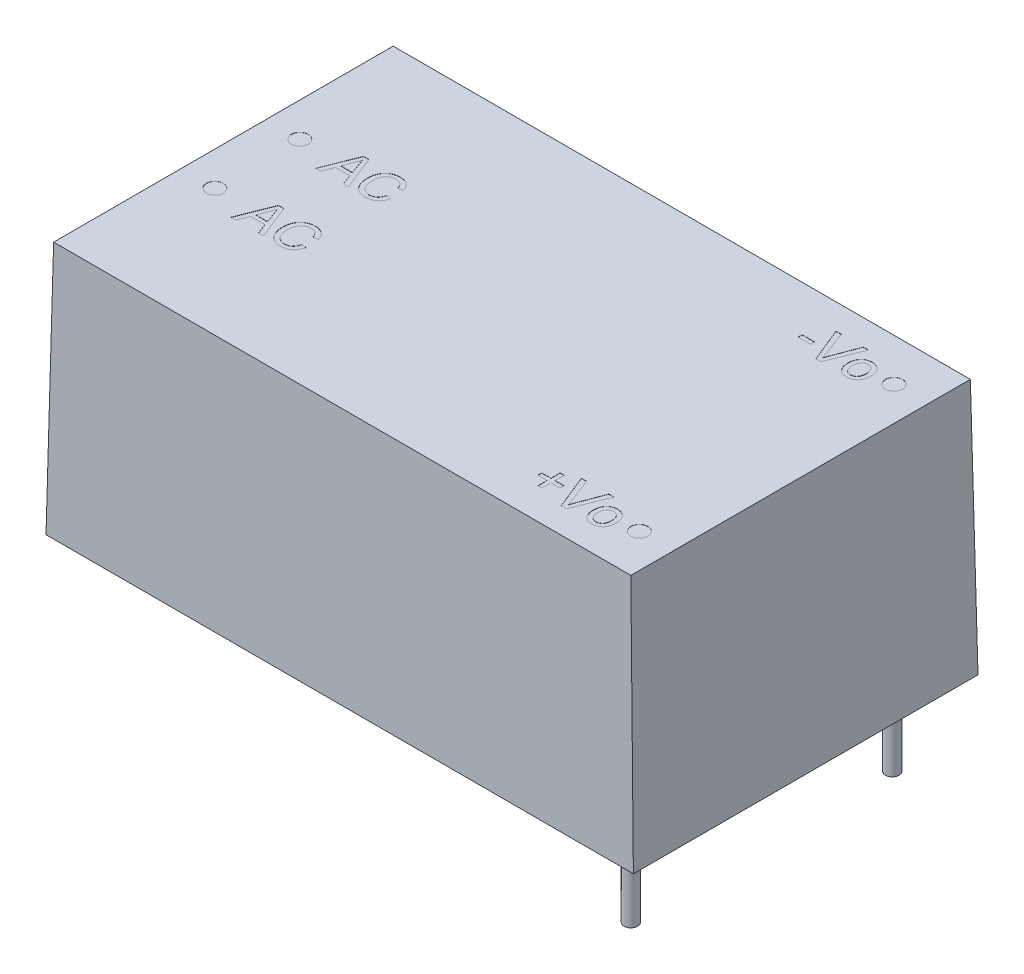
from build123d import *

# Parameters (mm, degrees)
SKETCH_3_R          = 0.4
EXTRUDE_1_DEPTH     = 5
EXTRUDE_1_2_DEPTH   = 5
EXTRUDE_1_3_DEPTH   = 5
EXTRUDE_1_4_DEPTH   = 5
SKETCH_4_R          = 0.5
SKETCH_4_W          = 0.743589744
SKETCH_4_H          = 0.230769231
CUT_EXTRUDE_1_DEPTH = 0.01


with BuildPart() as part:
    # Эскиз1 → По сечениям1 section 0
    with BuildSketch(Plane(origin=(0, 0, 0), x_dir=(1, 0, 0), z_dir=(0, 1, 0))):
        with BuildLine():
            Line((-17.3, 10.15), (17.3, 10.15))
            Line((17.3, 10.15), (17.3, -10.15))
            Line((17.3, -10.15), (-17.3, -10.15))
            Line((-17.3, -10.15), (-17.3, 10.15))
        make_face()
    # Эскиз2 → По сечениям1 section 1
    with BuildSketch(Plane(origin=(0, 15, 0), x_dir=(1, 0, 0), z_dir=(0, 1, 0))):
        with BuildLine():
            Line((-17, 10), (17, 10))
            Line((17, 10), (17, -10))
            Line((17, -10), (-17, -10))
            Line((-17, -10), (-17, 10))
        make_face()
    loft()

    # Эскиз4 → Вырез-Вытянуть1 (cut)
    # profile 1 of 14: a face of its own
    with BuildSketch(Plane(origin=(0, 15, 0), x_dir=(1, 0, 0), z_dir=(0, 1, 0))):
        with Locations((-15, 2.5)):
            Circle(SKETCH_4_R)
    # profile 2 of 14: a face of its own
    with BuildSketch(Plane(origin=(0, 15, 0), x_dir=(1, 0, 0), z_dir=(0, 1, 0))):
        with Locations((-15, -2.5)):
            Circle(SKETCH_4_R)
    # profile 3 of 14: a face of its own
    with BuildSketch(Plane(origin=(0, 15, 0), x_dir=(1, 0, 0), z_dir=(0, 1, 0))):
        with Locations((15, 7.5)):
            Circle(SKETCH_4_R)
    # profile 4 of 14: a face of its own
    with BuildSketch(Plane(origin=(0, 15, 0), x_dir=(1, 0, 0), z_dir=(0, 1, 0))):
        with Locations((15, -7.5)):
            Circle(SKETCH_4_R)
    # profile 5 of 14: a face of its own
    with BuildSketch(Plane(origin=(0, 15, 0), x_dir=(1, 0, 0), z_dir=(0, 1, 0))):
        Polygon((-13.04286859, 1.5), (-12.248798077, 3.5), (-11.930689103, 3.5), (-11.13661859, 1.5), (-11.435897436, 1.5), (-11.663461538, 2.115384615), (-12.516025641, 2.115384615), (-12.743589744, 1.5), align=None)
        with BuildLine():
            Line((-12.431089744, 2.346153846), (-11.748397436, 2.346153846))
            Line((-11.748397436, 2.346153846), (-11.942708333, 2.871794872))
            add(Edge.make_bspline(
                [(-11.942708333, 2.871794872), (-11.950157519, 2.892104925), (-11.964722085, 2.931814913), (-11.986442239, 2.989510174), (-12.006285423, 3.044299961), (-12.025743294, 3.095398669), (-12.043308261, 3.143548556), (-12.059498342, 3.188424393), (-12.075510195, 3.22971427), (-12.085119133, 3.256391785), (-12.08974359, 3.269230769)],
                knots=[0, 0, 0, 0, 1.225184869, 2.395467751, 3.491410812, 4.525364584, 5.492066482, 6.394148129, 7.227157926, 8, 8, 8, 8], degree=3))
            add(Edge.make_bspline(
                [(-12.08974359, 3.269230769), (-12.097393333, 3.237570966), (-12.112724362, 3.174120816), (-12.144823804, 3.081157834), (-12.181544451, 2.98904504), (-12.211365992, 2.929688185), (-12.226362179, 2.899839744)],
                knots=[0, 0, 0, 0, 0.9891762, 1.982431084, 2.985436691, 4, 4, 4, 4], degree=3))
            Line((-12.226362179, 2.899839744), (-12.431089744, 2.346153846))
        make_face(mode=Mode.SUBTRACT)
    # profile 6 of 14: a face of its own
    with BuildSketch(Plane(origin=(0, 15, 0), x_dir=(1, 0, 0), z_dir=(0, 1, 0))):
        with BuildLine():
            Line((-9.564102564, 2.205929487), (-9.282051282, 2.140224359))
            add(Edge.make_bspline(
                [(-9.282051282, 2.140224359), (-9.289117454, 2.113788476), (-9.302939763, 2.062076607), (-9.330268148, 1.988071199), (-9.360940908, 1.918620281), (-9.395702304, 1.853906797), (-9.434932796, 1.794302812), (-9.477592934, 1.739042298), (-9.525372427, 1.68928412), (-9.576518187, 1.643879887), (-9.631428441, 1.603833474), (-9.689441158, 1.569252662), (-9.750275918, 1.539831411), (-9.814178597, 1.51563718), (-9.881190621, 1.497428947), (-9.950966947, 1.48415772), (-10.023711036, 1.475983418), (-10.073295901, 1.474907247), (-10.098557692, 1.474358974)],
                knots=[0, 0, 0, 0, 1.145254194, 2.240259345, 3.299159039, 4.322497661, 5.312016644, 6.284080175, 7.241264552, 8.196044782, 9.144516039, 10.082428046, 11.020306713, 11.970622414, 12.939253955, 13.924100776, 14.94240044, 16, 16, 16, 16], degree=3))
            add(Edge.make_bspline(
                [(-10.098557692, 1.474358974), (-10.124476779, 1.474735532), (-10.175185401, 1.475472237), (-10.249470608, 1.481464402), (-10.320123135, 1.491856879), (-10.387011039, 1.506295738), (-10.450359457, 1.52414849), (-10.509905701, 1.546608834), (-10.565545472, 1.57351471), (-10.617742882, 1.604113645), (-10.666276229, 1.638875413), (-10.712249178, 1.676861888), (-10.75454566, 1.719118797), (-10.794223247, 1.764648414), (-10.830417746, 1.814051337), (-10.86446076, 1.866656409), (-10.89469067, 1.923390528), (-10.922227774, 1.983201841), (-10.946397678, 2.045511268), (-10.967779589, 2.109088026), (-10.98526047, 2.174058798), (-11.00031038, 2.239876867), (-11.011243411, 2.307096046), (-11.019923899, 2.375211985), (-11.024696606, 2.444642295), (-11.025324644, 2.491312842), (-11.025641026, 2.514823718)],
                knots=[0, 0, 0, 0, 1.180702053, 2.309949215, 3.392367133, 4.431746864, 5.425408375, 6.388154007, 7.326956194, 8.237882283, 9.141054626, 10.043899035, 10.951650021, 11.86168169, 12.792564695, 13.739356664, 14.713891418, 15.718426911, 16.737522708, 17.757217648, 18.772674716, 19.801476837, 20.831699174, 21.873853055, 22.928926693, 24, 24, 24, 24], degree=3))
            add(Edge.make_bspline(
                [(-11.025641026, 2.514823718), (-11.025188533, 2.540204657), (-11.024294521, 2.590350981), (-11.01924784, 2.664343339), (-11.009978916, 2.735755016), (-10.997107076, 2.804632985), (-10.980819049, 2.871033028), (-10.960713306, 2.934987495), (-10.937044183, 2.996414555), (-10.909883839, 3.055381946), (-10.879051827, 3.111231435), (-10.845468354, 3.164042418), (-10.808332328, 3.21294776), (-10.768744775, 3.258881813), (-10.72571697, 3.301079722), (-10.679380301, 3.339637077), (-10.63013454, 3.374905568), (-10.577986877, 3.406557777), (-10.523618941, 3.434330935), (-10.467838272, 3.459068728), (-10.410423006, 3.479344713), (-10.351828348, 3.496203379), (-10.291928148, 3.509624443), (-10.230582443, 3.518599151), (-10.167847917, 3.524447765), (-10.125547401, 3.525240393), (-10.104166667, 3.525641026)],
                knots=[0, 0, 0, 0, 1.185634383, 2.342514083, 3.462112933, 4.547331452, 5.613960142, 6.653690668, 7.676612054, 8.686959706, 9.683658101, 10.654407272, 11.607580201, 12.5494388, 13.484601218, 14.419076806, 15.362504069, 16.311442244, 17.265594461, 18.212500624, 19.159571152, 20.107257795, 21.059246075, 22.024387127, 23.001429356, 24, 24, 24, 24], degree=3))
            add(Edge.make_bspline(
                [(-10.104166667, 3.525641026), (-10.080244505, 3.525190105), (-10.033223128, 3.524303775), (-9.964227636, 3.517013539), (-9.898147968, 3.504803191), (-9.83469779, 3.48878437), (-9.774536781, 3.466851269), (-9.717011791, 3.440775332), (-9.662695078, 3.409448254), (-9.611164013, 3.373730957), (-9.563257442, 3.333557572), (-9.518304963, 3.28988783), (-9.478139502, 3.241630304), (-9.441170264, 3.189952915), (-9.408560423, 3.134139071), (-9.379110296, 3.074675411), (-9.353784044, 3.01111989), (-9.340233238, 2.966851712), (-9.333333333, 2.944310897)],
                knots=[0, 0, 0, 0, 1.098391872, 2.158997981, 3.181470371, 4.182549255, 5.160268219, 6.118029851, 7.079534476, 8.035645336, 8.993622929, 9.94770573, 10.909620999, 11.872786677, 12.862530088, 13.874594564, 14.917769567, 16, 16, 16, 16], degree=3))
            Line((-9.333333333, 2.944310897), (-9.615384615, 2.883814103))
            add(Edge.make_bspline(
                [(-9.615384615, 2.883814103), (-9.620923662, 2.90111302), (-9.631765291, 2.934972355), (-9.651015663, 2.983227925), (-9.671805423, 3.028024859), (-9.694629801, 3.069058649), (-9.71953826, 3.106339124), (-9.745957227, 3.140319371), (-9.774519672, 3.170365145), (-9.804644611, 3.197169226), (-9.83710996, 3.220003739), (-9.871154588, 3.240238875), (-9.907496328, 3.256980364), (-9.945612376, 3.271140205), (-9.985858998, 3.28191737), (-10.028072306, 3.289499531), (-10.072289389, 3.293887714), (-10.102420847, 3.294539415), (-10.117788462, 3.294871795)],
                knots=[0, 0, 0, 0, 1.235697765, 2.418642872, 3.532555292, 4.594392283, 5.610119701, 6.580908344, 7.519430642, 8.427315627, 9.319973334, 10.216139639, 11.118687699, 12.038725643, 12.980015607, 13.949697744, 14.954307006, 16, 16, 16, 16], degree=3))
            add(Edge.make_bspline(
                [(-10.117788462, 3.294871795), (-10.135431889, 3.294615806), (-10.170131304, 3.294112352), (-10.221108919, 3.288602104), (-10.27006516, 3.280486045), (-10.316635158, 3.268315317), (-10.361073747, 3.253141585), (-10.403117222, 3.234247603), (-10.443123222, 3.212101641), (-10.48064526, 3.186570708), (-10.515367997, 3.157869025), (-10.548233709, 3.127526856), (-10.577664475, 3.094129112), (-10.60478258, 3.058777046), (-10.628798345, 3.020845965), (-10.650416557, 2.980852533), (-10.669499416, 2.938468975), (-10.690301027, 2.878817326), (-10.711511059, 2.801987383), (-10.729910787, 2.707972434), (-10.74163098, 2.612476286), (-10.742935442, 2.548243836), (-10.743589744, 2.516025641)],
                knots=[0, 0, 0, 0, 0.935256702, 1.839373932, 2.716087708, 3.564631604, 4.388828665, 5.203538865, 6.005592122, 6.810952829, 7.606223804, 8.392839071, 9.180346482, 9.963639178, 10.753404291, 11.558266631, 12.372976832, 13.215232055, 14.905983541, 16.594894834, 18.292041732, 20, 20, 20, 20], degree=3))
            add(Edge.make_bspline(
                [(-10.743589744, 2.516025641), (-10.742851784, 2.475516652), (-10.741420076, 2.396925545), (-10.727292633, 2.28303405), (-10.705753409, 2.17680394), (-10.679758669, 2.093923289), (-10.653683333, 2.03278896), (-10.632594912, 1.989975708), (-10.60852332, 1.950358401), (-10.582067306, 1.913712049), (-10.552886088, 1.880143547), (-10.521386221, 1.849474577), (-10.487560667, 1.821410031), (-10.451008627, 1.797263663), (-10.413137032, 1.775823793), (-10.374423793, 1.756759051), (-10.334844535, 1.740634937), (-10.294239573, 1.728109397), (-10.253179109, 1.717285589), (-10.211210904, 1.71021497), (-10.168346926, 1.706224535), (-10.139564824, 1.705496579), (-10.125, 1.705128205)],
                knots=[0, 0, 0, 0, 2.10686522, 4.087509323, 5.961373225, 7.741398778, 8.594514555, 9.418024779, 10.222433421, 11.003575649, 11.767087398, 12.533660211, 13.289033706, 14.050297079, 14.809623433, 15.552362432, 16.294320901, 17.0305302, 17.761969017, 18.502233515, 19.242073914, 20, 20, 20, 20], degree=3))
            add(Edge.make_bspline(
                [(-10.125, 1.705128205), (-10.107618877, 1.705492724), (-10.073285012, 1.706212777), (-10.022947208, 1.712515445), (-9.974422258, 1.72180325), (-9.928298036, 1.736135271), (-9.883954119, 1.753683151), (-9.841753829, 1.775322757), (-9.801829881, 1.801348886), (-9.763712679, 1.830899112), (-9.72810514, 1.864522219), (-9.695472745, 1.901947323), (-9.666197799, 1.94334504), (-9.639052558, 1.988050997), (-9.616245566, 2.037400726), (-9.595120907, 2.089923329), (-9.577518314, 2.146482061), (-9.568638721, 2.185829022), (-9.564102564, 2.205929487)],
                knots=[0, 0, 0, 0, 1.013374089, 2.001772144, 2.95501459, 3.891367103, 4.814208647, 5.733921849, 6.652182523, 7.590185968, 8.54346024, 9.504121027, 10.481158517, 11.497760682, 12.549996529, 13.647863555, 14.798406869, 16, 16, 16, 16], degree=3))
        make_face()
    # profile 7 of 14: a face of its own
    with BuildSketch(Plane(origin=(0, 15, 0), x_dir=(1, 0, 0), z_dir=(0, 1, 0))):
        Polygon((-13.04286859, -3.5), (-12.248798077, -1.5), (-11.930689103, -1.5), (-11.13661859, -3.5), (-11.435897436, -3.5), (-11.663461538, -2.884615385), (-12.516025641, -2.884615385), (-12.743589744, -3.5), align=None)
        with BuildLine():
            Line((-12.431089744, -2.653846154), (-11.748397436, -2.653846154))
            Line((-11.748397436, -2.653846154), (-11.942708333, -2.128205128))
            add(Edge.make_bspline(
                [(-11.942708333, -2.128205128), (-11.950157519, -2.107895075), (-11.964722085, -2.068185087), (-11.986442239, -2.010489826), (-12.006285423, -1.955700039), (-12.025743294, -1.904601331), (-12.043308261, -1.856451444), (-12.059498342, -1.811575607), (-12.075510195, -1.77028573), (-12.085119133, -1.743608215), (-12.08974359, -1.730769231)],
                knots=[0, 0, 0, 0, 1.225184869, 2.395467751, 3.491410812, 4.525364584, 5.492066482, 6.394148129, 7.227157926, 8, 8, 8, 8], degree=3))
            add(Edge.make_bspline(
                [(-12.08974359, -1.730769231), (-12.097393333, -1.762429034), (-12.112724362, -1.825879184), (-12.144823804, -1.918842166), (-12.181544451, -2.01095496), (-12.211365992, -2.070311815), (-12.226362179, -2.100160256)],
                knots=[0, 0, 0, 0, 0.9891762, 1.982431084, 2.985436691, 4, 4, 4, 4], degree=3))
            Line((-12.226362179, -2.100160256), (-12.431089744, -2.653846154))
        make_face(mode=Mode.SUBTRACT)
    # profile 8 of 14: a face of its own
    with BuildSketch(Plane(origin=(0, 15, 0), x_dir=(1, 0, 0), z_dir=(0, 1, 0))):
        with BuildLine():
            Line((-9.564102564, -2.794070513), (-9.282051282, -2.859775641))
            add(Edge.make_bspline(
                [(-9.282051282, -2.859775641), (-9.289117454, -2.886211524), (-9.302939763, -2.937923393), (-9.330268148, -3.011928801), (-9.360940908, -3.081379719), (-9.395702304, -3.146093203), (-9.434932796, -3.205697188), (-9.477592934, -3.260957702), (-9.525372427, -3.31071588), (-9.576518187, -3.356120113), (-9.631428441, -3.396166526), (-9.689441158, -3.430747338), (-9.750275918, -3.460168589), (-9.814178597, -3.48436282), (-9.881190621, -3.502571053), (-9.950966947, -3.51584228), (-10.023711036, -3.524016582), (-10.073295901, -3.525092753), (-10.098557692, -3.525641026)],
                knots=[0, 0, 0, 0, 1.145254194, 2.240259345, 3.299159039, 4.322497661, 5.312016644, 6.284080175, 7.241264552, 8.196044782, 9.144516039, 10.082428046, 11.020306713, 11.970622414, 12.939253955, 13.924100776, 14.94240044, 16, 16, 16, 16], degree=3))
            add(Edge.make_bspline(
                [(-10.098557692, -3.525641026), (-10.124476779, -3.525264468), (-10.175185401, -3.524527763), (-10.249470608, -3.518535598), (-10.320123135, -3.508143121), (-10.387011039, -3.493704262), (-10.450359457, -3.47585151), (-10.509905701, -3.453391166), (-10.565545472, -3.42648529), (-10.617742882, -3.395886355), (-10.666276229, -3.361124587), (-10.712249178, -3.323138112), (-10.75454566, -3.280881203), (-10.794223247, -3.235351586), (-10.830417746, -3.185948663), (-10.86446076, -3.133343591), (-10.89469067, -3.076609472), (-10.922227774, -3.016798159), (-10.946397678, -2.954488732), (-10.967779589, -2.890911974), (-10.98526047, -2.825941202), (-11.00031038, -2.760123133), (-11.011243411, -2.692903954), (-11.019923899, -2.624788015), (-11.024696606, -2.555357705), (-11.025324644, -2.508687158), (-11.025641026, -2.485176282)],
                knots=[0, 0, 0, 0, 1.180702053, 2.309949215, 3.392367133, 4.431746864, 5.425408375, 6.388154007, 7.326956194, 8.237882283, 9.141054626, 10.043899035, 10.951650021, 11.86168169, 12.792564695, 13.739356664, 14.713891418, 15.718426911, 16.737522708, 17.757217648, 18.772674716, 19.801476837, 20.831699174, 21.873853055, 22.928926693, 24, 24, 24, 24], degree=3))
            add(Edge.make_bspline(
                [(-11.025641026, -2.485176282), (-11.025188533, -2.459795343), (-11.024294521, -2.409649019), (-11.01924784, -2.335656661), (-11.009978916, -2.264244984), (-10.997107076, -2.195367015), (-10.980819049, -2.128966972), (-10.960713306, -2.065012505), (-10.937044183, -2.003585445), (-10.909883839, -1.944618054), (-10.879051827, -1.888768565), (-10.845468354, -1.835957582), (-10.808332328, -1.78705224), (-10.768744775, -1.741118187), (-10.72571697, -1.698920278), (-10.679380301, -1.660362923), (-10.63013454, -1.625094432), (-10.577986877, -1.593442223), (-10.523618941, -1.565669065), (-10.467838272, -1.540931272), (-10.410423006, -1.520655287), (-10.351828348, -1.503796621), (-10.291928148, -1.490375557), (-10.230582443, -1.481400849), (-10.167847917, -1.475552235), (-10.125547401, -1.474759607), (-10.104166667, -1.474358974)],
                knots=[0, 0, 0, 0, 1.185634383, 2.342514083, 3.462112933, 4.547331452, 5.613960142, 6.653690668, 7.676612054, 8.686959706, 9.683658101, 10.654407272, 11.607580201, 12.5494388, 13.484601218, 14.419076806, 15.362504069, 16.311442244, 17.265594461, 18.212500624, 19.159571152, 20.107257795, 21.059246075, 22.024387127, 23.001429356, 24, 24, 24, 24], degree=3))
            add(Edge.make_bspline(
                [(-10.104166667, -1.474358974), (-10.080244505, -1.474809895), (-10.033223128, -1.475696225), (-9.964227636, -1.482986461), (-9.898147968, -1.495196809), (-9.83469779, -1.51121563), (-9.774536781, -1.533148731), (-9.717011791, -1.559224668), (-9.662695078, -1.590551746), (-9.611164013, -1.626269043), (-9.563257442, -1.666442428), (-9.518304963, -1.71011217), (-9.478139502, -1.758369696), (-9.441170264, -1.810047085), (-9.408560423, -1.865860929), (-9.379110296, -1.925324589), (-9.353784044, -1.98888011), (-9.340233238, -2.033148288), (-9.333333333, -2.055689103)],
                knots=[0, 0, 0, 0, 1.098391872, 2.158997981, 3.181470371, 4.182549255, 5.160268219, 6.118029851, 7.079534476, 8.035645336, 8.993622929, 9.94770573, 10.909620999, 11.872786677, 12.862530088, 13.874594564, 14.917769567, 16, 16, 16, 16], degree=3))
            Line((-9.333333333, -2.055689103), (-9.615384615, -2.116185897))
            add(Edge.make_bspline(
                [(-9.615384615, -2.116185897), (-9.620923662, -2.09888698), (-9.631765291, -2.065027645), (-9.651015663, -2.016772075), (-9.671805423, -1.971975141), (-9.694629801, -1.930941351), (-9.71953826, -1.893660876), (-9.745957227, -1.859680629), (-9.774519672, -1.829634855), (-9.804644611, -1.802830774), (-9.83710996, -1.779996261), (-9.871154588, -1.759761125), (-9.907496328, -1.743019636), (-9.945612376, -1.728859795), (-9.985858998, -1.71808263), (-10.028072306, -1.710500469), (-10.072289389, -1.706112286), (-10.102420847, -1.705460585), (-10.117788462, -1.705128205)],
                knots=[0, 0, 0, 0, 1.235697765, 2.418642872, 3.532555292, 4.594392283, 5.610119701, 6.580908344, 7.519430642, 8.427315627, 9.319973334, 10.216139639, 11.118687699, 12.038725643, 12.980015607, 13.949697744, 14.954307006, 16, 16, 16, 16], degree=3))
            add(Edge.make_bspline(
                [(-10.117788462, -1.705128205), (-10.135431889, -1.705384194), (-10.170131304, -1.705887648), (-10.221108919, -1.711397896), (-10.27006516, -1.719513955), (-10.316635158, -1.731684683), (-10.361073747, -1.746858415), (-10.403117222, -1.765752397), (-10.443123222, -1.787898359), (-10.48064526, -1.813429292), (-10.515367997, -1.842130975), (-10.548233709, -1.872473144), (-10.577664475, -1.905870888), (-10.60478258, -1.941222954), (-10.628798345, -1.979154035), (-10.650416557, -2.019147467), (-10.669499416, -2.061531025), (-10.690301027, -2.121182674), (-10.711511059, -2.198012617), (-10.729910787, -2.292027566), (-10.74163098, -2.387523714), (-10.742935442, -2.451756164), (-10.743589744, -2.483974359)],
                knots=[0, 0, 0, 0, 0.935256702, 1.839373932, 2.716087708, 3.564631604, 4.388828665, 5.203538865, 6.005592122, 6.810952829, 7.606223804, 8.392839071, 9.180346482, 9.963639178, 10.753404291, 11.558266631, 12.372976832, 13.215232055, 14.905983541, 16.594894834, 18.292041732, 20, 20, 20, 20], degree=3))
            add(Edge.make_bspline(
                [(-10.743589744, -2.483974359), (-10.742851784, -2.524483348), (-10.741420076, -2.603074455), (-10.727292633, -2.71696595), (-10.705753409, -2.82319606), (-10.679758669, -2.906076711), (-10.653683333, -2.96721104), (-10.632594912, -3.010024292), (-10.60852332, -3.049641599), (-10.582067306, -3.086287951), (-10.552886088, -3.119856453), (-10.521386221, -3.150525423), (-10.487560667, -3.178589969), (-10.451008627, -3.202736337), (-10.413137032, -3.224176207), (-10.374423793, -3.243240949), (-10.334844535, -3.259365063), (-10.294239573, -3.271890603), (-10.253179109, -3.282714411), (-10.211210904, -3.28978503), (-10.168346926, -3.293775465), (-10.139564824, -3.294503421), (-10.125, -3.294871795)],
                knots=[0, 0, 0, 0, 2.10686522, 4.087509323, 5.961373225, 7.741398778, 8.594514555, 9.418024779, 10.222433421, 11.003575649, 11.767087398, 12.533660211, 13.289033706, 14.050297079, 14.809623433, 15.552362432, 16.294320901, 17.0305302, 17.761969017, 18.502233515, 19.242073914, 20, 20, 20, 20], degree=3))
            add(Edge.make_bspline(
                [(-10.125, -3.294871795), (-10.107618877, -3.294507276), (-10.073285012, -3.293787223), (-10.022947208, -3.287484555), (-9.974422258, -3.27819675), (-9.928298036, -3.263864729), (-9.883954119, -3.246316849), (-9.841753829, -3.224677243), (-9.801829881, -3.198651114), (-9.763712679, -3.169100888), (-9.72810514, -3.135477781), (-9.695472745, -3.098052677), (-9.666197799, -3.05665496), (-9.639052558, -3.011949003), (-9.616245566, -2.962599274), (-9.595120907, -2.910076671), (-9.577518314, -2.853517939), (-9.568638721, -2.814170978), (-9.564102564, -2.794070513)],
                knots=[0, 0, 0, 0, 1.013374089, 2.001772144, 2.95501459, 3.891367103, 4.814208647, 5.733921849, 6.652182523, 7.590185968, 8.54346024, 9.504121027, 10.481158517, 11.497760682, 12.549996529, 13.647863555, 14.798406869, 16, 16, 16, 16], degree=3))
        make_face()
    # profile 9 of 14: a face of its own
    with BuildSketch(Plane(origin=(0, 15, 0), x_dir=(1, 0, 0), z_dir=(0, 1, 0))):
        with BuildLine():
            add(Edge.make_bspline(
                [(12.564102564, 7.230769231), (12.564820561, 7.263246316), (12.566209938, 7.326091847), (12.576159113, 7.417285552), (12.593216248, 7.501949247), (12.617153598, 7.580162449), (12.648109335, 7.651949802), (12.686351236, 7.716908533), (12.730824596, 7.776232049), (12.766316872, 7.809764342), (12.784054487, 7.826522436)],
                knots=[0, 0, 0, 0, 1.189940866, 2.302622481, 3.356378305, 4.350088409, 5.294652018, 6.213657312, 7.107257627, 8, 8, 8, 8], degree=3))
            add(Edge.make_bspline(
                [(12.784054487, 7.826522436), (12.799568371, 7.839401185), (12.830313066, 7.864923692), (12.88049412, 7.897290212), (12.932738182, 7.925098606), (12.987506899, 7.948156012), (13.044973362, 7.965772703), (13.104958626, 7.977999474), (13.16738602, 7.985987507), (13.209910646, 7.986777238), (13.231570513, 7.987179487)],
                knots=[0, 0, 0, 0, 0.994414631, 1.970684744, 2.940793954, 3.912782355, 4.898970837, 5.902128985, 6.931451948, 8, 8, 8, 8], degree=3))
            add(Edge.make_bspline(
                [(13.231570513, 7.987179487), (13.255497047, 7.986504438), (13.302313746, 7.985183578), (13.371014735, 7.976570133), (13.436069858, 7.960563294), (13.498316779, 7.939584699), (13.55681293, 7.911627196), (13.612482237, 7.878296121), (13.66396157, 7.837901542), (13.712237566, 7.79224312), (13.755788118, 7.741181968), (13.793731138, 7.684968973), (13.825863451, 7.62408973), (13.85240651, 7.558486521), (13.872762277, 7.488113486), (13.886950766, 7.413121015), (13.896040015, 7.333690754), (13.896963144, 7.279139008), (13.897435897, 7.251201923)],
                knots=[0, 0, 0, 0, 1.026363227, 2.008269884, 2.962742747, 3.895658536, 4.820662428, 5.738204837, 6.673158329, 7.621267452, 8.584296177, 9.545483285, 10.524327568, 11.531652541, 12.575780624, 13.660990097, 14.802144351, 16, 16, 16, 16], degree=3))
            add(Edge.make_bspline(
                [(13.897435897, 7.251201923), (13.897257772, 7.228492047), (13.896911699, 7.184369798), (13.892728466, 7.120079871), (13.886406966, 7.059519055), (13.877803259, 7.002618427), (13.866213652, 6.949469219), (13.851761254, 6.900114107), (13.835000782, 6.854286537), (13.81573766, 6.811937596), (13.793757644, 6.772725185), (13.769812072, 6.735804145), (13.743299003, 6.701230487), (13.714252422, 6.669061511), (13.683064293, 6.639063914), (13.649521819, 6.611123975), (13.613563084, 6.585643937), (13.562796519, 6.554707768), (13.495790971, 6.522290017), (13.410925089, 6.494508688), (13.322387453, 6.477576138), (13.262093345, 6.475440237), (13.231570513, 6.474358974)],
                knots=[0, 0, 0, 0, 1.174068422, 2.28105775, 3.329581501, 4.321819531, 5.255045276, 6.14001734, 6.978936381, 7.776151739, 8.542754425, 9.301196708, 10.049767304, 10.792968067, 11.540167917, 12.285482871, 13.048063169, 13.816653646, 15.357768987, 16.884132754, 18.422646949, 20, 20, 20, 20], degree=3))
            add(Edge.make_bspline(
                [(13.231570513, 6.474358974), (13.207239283, 6.475018871), (13.159616248, 6.476310472), (13.089943599, 6.485122895), (13.023820003, 6.50022305), (12.961444921, 6.522228156), (12.902262428, 6.549240467), (12.846831788, 6.582961152), (12.795045895, 6.622655465), (12.747362094, 6.668579488), (12.70376315, 6.719709951), (12.666545918, 6.777144714), (12.634692517, 6.839699155), (12.608668346, 6.907643055), (12.588789509, 6.980978458), (12.574514058, 7.059512303), (12.56549059, 7.143352557), (12.564573693, 7.201097964), (12.564102564, 7.230769231)],
                knots=[0, 0, 0, 0, 1.022681766, 2.001674804, 2.94671416, 3.868132449, 4.777362857, 5.676573364, 6.589418535, 7.514523194, 8.454681358, 9.407574523, 10.384198733, 11.400667853, 12.460217505, 13.573389442, 14.753137007, 16, 16, 16, 16], degree=3))
        make_face()
        with BuildLine():
            add(Edge.make_bspline(
                [(12.820512821, 7.231570513), (12.820947967, 7.210194023), (12.821789684, 7.168844802), (12.826813104, 7.108827905), (12.835989969, 7.053109461), (12.848757097, 7.001487044), (12.865132445, 6.953953332), (12.885202264, 6.910427849), (12.908747594, 6.870873697), (12.936279349, 6.8359357), (12.966243282, 6.805054389), (12.998561876, 6.778416811), (13.03278568, 6.755798188), (13.068972856, 6.737355617), (13.106959533, 6.722784329), (13.146828359, 6.712292736), (13.188650036, 6.706268437), (13.217128347, 6.705511878), (13.231570513, 6.705128205)],
                knots=[0, 0, 0, 0, 1.36128903, 2.633184439, 3.831299874, 4.953299848, 6.015607462, 7.027679361, 8.000438392, 8.93945591, 9.853536715, 10.73548639, 11.60109037, 12.460616037, 13.316600729, 14.187036799, 15.080594522, 16, 16, 16, 16], degree=3))
            add(Edge.make_bspline(
                [(13.231570513, 6.705128205), (13.245888573, 6.705455405), (13.274139538, 6.706101004), (13.315416789, 6.712936002), (13.355142544, 6.722741493), (13.392988584, 6.737210065), (13.42864002, 6.756295425), (13.46278771, 6.778870873), (13.494739493, 6.805898178), (13.525046233, 6.836720319), (13.552184595, 6.872173835), (13.576526956, 6.911571337), (13.596527119, 6.955803741), (13.612695907, 7.004193711), (13.625604426, 7.056844271), (13.634738555, 7.113775527), (13.639732641, 7.175124231), (13.640586083, 7.217405874), (13.641025641, 7.239182692)],
                knots=[0, 0, 0, 0, 0.904535546, 1.784739026, 2.638791991, 3.488785886, 4.338695884, 5.191202824, 6.07237792, 6.980061329, 7.919174549, 8.889507933, 9.902165842, 10.981000531, 12.111539881, 13.326270405, 14.622917219, 16, 16, 16, 16], degree=3))
            add(Edge.make_bspline(
                [(13.641025641, 7.239182692), (13.640582378, 7.25975723), (13.639720303, 7.299771356), (13.634753111, 7.357934654), (13.625458296, 7.412153), (13.612939473, 7.462579214), (13.595779269, 7.508798065), (13.576061594, 7.55168577), (13.551719185, 7.590391718), (13.524103002, 7.62513423), (13.493961098, 7.656052806), (13.46192877, 7.683187029), (13.427672341, 7.705470565), (13.392017092, 7.724415278), (13.354385562, 7.738570536), (13.315133376, 7.749278043), (13.273958103, 7.755282359), (13.245878688, 7.756029528), (13.231570513, 7.756410256)],
                knots=[0, 0, 0, 0, 1.329905342, 2.586449315, 3.768451236, 4.882143757, 5.938857988, 6.950440627, 7.927559667, 8.885972819, 9.813736587, 10.714405609, 11.592966897, 12.450023853, 13.318821862, 14.185602452, 15.075453733, 16, 16, 16, 16], degree=3))
            add(Edge.make_bspline(
                [(13.231570513, 7.756410256), (13.217129574, 7.756023398), (13.188653682, 7.755260557), (13.146814403, 7.749281962), (13.107055695, 7.73863519), (13.068875449, 7.724699189), (13.032821885, 7.706079347), (12.99839988, 7.683584901), (12.966525658, 7.656442681), (12.936108445, 7.626038947), (12.908892552, 7.591097002), (12.885186967, 7.55194036), (12.865052606, 7.508686874), (12.848768813, 7.461249129), (12.835986576, 7.409632161), (12.826813877, 7.353912121), (12.821801515, 7.294028815), (12.820951122, 7.252813373), (12.820512821, 7.231570513)],
                knots=[0, 0, 0, 0, 0.920966903, 1.816042154, 2.687956485, 3.542385364, 4.403370762, 5.270444796, 6.159337503, 7.068888003, 8.009500254, 8.976623456, 9.982690403, 11.046802133, 12.170707598, 13.370857791, 14.644913259, 16, 16, 16, 16], degree=3))
        make_face(mode=Mode.SUBTRACT)
    # profile 10 of 14: a face of its own
    with BuildSketch(Plane(origin=(0, 15, 0), x_dir=(1, 0, 0), z_dir=(0, 1, 0))):
        with BuildLine():
            Line((11.398237179, 6.5), (10.591746795, 8.5))
            Line((10.591746795, 8.5), (10.897435897, 8.5))
            Line((10.897435897, 8.5), (11.44150641, 7.06650641))
            add(Edge.make_bspline(
                [(11.44150641, 7.06650641), (11.452153331, 7.038230134), (11.472980903, 6.982915906), (11.50202497, 6.900833384), (11.527988617, 6.821455402), (11.543641771, 6.769129793), (11.551282051, 6.743589744)],
                knots=[0, 0, 0, 0, 1.062747156, 2.078952616, 3.062339733, 4, 4, 4, 4], degree=3))
            add(Edge.make_bspline(
                [(11.551282051, 6.743589744), (11.567547082, 6.797598018), (11.600310346, 6.906388914), (11.639913333, 7.012881249), (11.659855769, 7.06650641)],
                knots=[0, 0, 0, 0, 0.992882236, 2, 2, 2, 2], degree=3))
            Line((11.659855769, 7.06650641), (12.205128205, 8.5))
            Line((12.205128205, 8.5), (12.510817308, 8.5))
            Line((12.510817308, 8.5), (11.703926282, 6.5))
            Line((11.703926282, 6.5), (11.398237179, 6.5))
        make_face()
    # profile 11 of 14: a face of its own
    with BuildSketch(Plane(origin=(0, 15, 0), x_dir=(1, 0, 0), z_dir=(0, 1, 0))):
        with Locations((10.141025641, 7.205128206)):
            Rectangle(SKETCH_4_W, SKETCH_4_H)
    # profile 12 of 14: a face of its own
    with BuildSketch(Plane(origin=(0, 15, 0), x_dir=(1, 0, 0), z_dir=(0, 1, 0))):
        with BuildLine():
            add(Edge.make_bspline(
                [(12.564102564, -7.769230769), (12.564820561, -7.736753684), (12.566209938, -7.673908153), (12.576159113, -7.582714448), (12.593216248, -7.498050753), (12.617153598, -7.419837551), (12.648109335, -7.348050198), (12.686351236, -7.283091467), (12.730824596, -7.223767951), (12.766316872, -7.190235658), (12.784054487, -7.173477564)],
                knots=[0, 0, 0, 0, 1.189940866, 2.302622481, 3.356378305, 4.350088409, 5.294652018, 6.213657312, 7.107257627, 8, 8, 8, 8], degree=3))
            add(Edge.make_bspline(
                [(12.784054487, -7.173477564), (12.799568371, -7.160598815), (12.830313066, -7.135076308), (12.88049412, -7.102709788), (12.932738182, -7.074901394), (12.987506899, -7.051843988), (13.044973362, -7.034227297), (13.104958626, -7.022000526), (13.16738602, -7.014012493), (13.209910646, -7.013222762), (13.231570513, -7.012820513)],
                knots=[0, 0, 0, 0, 0.994414631, 1.970684744, 2.940793954, 3.912782355, 4.898970837, 5.902128985, 6.931451948, 8, 8, 8, 8], degree=3))
            add(Edge.make_bspline(
                [(13.231570513, -7.012820513), (13.255497047, -7.013495562), (13.302313746, -7.014816422), (13.371014735, -7.023429867), (13.436069858, -7.039436706), (13.498316779, -7.060415301), (13.55681293, -7.088372804), (13.612482237, -7.121703879), (13.66396157, -7.162098458), (13.712237566, -7.20775688), (13.755788118, -7.258818032), (13.793731138, -7.315031027), (13.825863451, -7.37591027), (13.85240651, -7.441513479), (13.872762277, -7.511886514), (13.886950766, -7.586878985), (13.896040015, -7.666309246), (13.896963144, -7.720860992), (13.897435897, -7.748798077)],
                knots=[0, 0, 0, 0, 1.026363227, 2.008269884, 2.962742747, 3.895658536, 4.820662428, 5.738204837, 6.673158329, 7.621267452, 8.584296177, 9.545483285, 10.524327568, 11.531652541, 12.575780624, 13.660990097, 14.802144351, 16, 16, 16, 16], degree=3))
            add(Edge.make_bspline(
                [(13.897435897, -7.748798077), (13.897257772, -7.771507953), (13.896911699, -7.815630202), (13.892728466, -7.879920129), (13.886406966, -7.940480945), (13.877803259, -7.997381573), (13.866213652, -8.050530781), (13.851761254, -8.099885893), (13.835000782, -8.145713463), (13.81573766, -8.188062404), (13.793757644, -8.227274815), (13.769812072, -8.264195855), (13.743299003, -8.298769513), (13.714252422, -8.330938489), (13.683064293, -8.360936086), (13.649521819, -8.388876025), (13.613563084, -8.414356063), (13.562796519, -8.445292232), (13.495790971, -8.477709983), (13.410925089, -8.505491312), (13.322387453, -8.522423862), (13.262093345, -8.524559763), (13.231570513, -8.525641026)],
                knots=[0, 0, 0, 0, 1.174068422, 2.28105775, 3.329581501, 4.321819531, 5.255045276, 6.14001734, 6.978936381, 7.776151739, 8.542754425, 9.301196708, 10.049767304, 10.792968067, 11.540167917, 12.285482871, 13.048063169, 13.816653646, 15.357768987, 16.884132754, 18.422646949, 20, 20, 20, 20], degree=3))
            add(Edge.make_bspline(
                [(13.231570513, -8.525641026), (13.207239283, -8.524981129), (13.159616248, -8.523689528), (13.089943599, -8.514877105), (13.023820003, -8.49977695), (12.961444921, -8.477771844), (12.902262428, -8.450759533), (12.846831788, -8.417038848), (12.795045895, -8.377344535), (12.747362094, -8.331420512), (12.70376315, -8.280290049), (12.666545918, -8.222855286), (12.634692517, -8.160300845), (12.608668346, -8.092356945), (12.588789509, -8.019021542), (12.574514058, -7.940487697), (12.56549059, -7.856647443), (12.564573693, -7.798902036), (12.564102564, -7.769230769)],
                knots=[0, 0, 0, 0, 1.022681766, 2.001674804, 2.94671416, 3.868132449, 4.777362857, 5.676573364, 6.589418535, 7.514523194, 8.454681358, 9.407574523, 10.384198733, 11.400667853, 12.460217505, 13.573389442, 14.753137007, 16, 16, 16, 16], degree=3))
        make_face()
        with BuildLine():
            add(Edge.make_bspline(
                [(12.820512821, -7.768429487), (12.820947967, -7.789805977), (12.821789684, -7.831155198), (12.826813104, -7.891172095), (12.835989969, -7.946890539), (12.848757097, -7.998512956), (12.865132445, -8.046046668), (12.885202264, -8.089572151), (12.908747594, -8.129126303), (12.936279349, -8.1640643), (12.966243282, -8.194945611), (12.998561876, -8.221583189), (13.03278568, -8.244201812), (13.068972856, -8.262644383), (13.106959533, -8.277215671), (13.146828359, -8.287707264), (13.188650036, -8.293731563), (13.217128347, -8.294488122), (13.231570513, -8.294871795)],
                knots=[0, 0, 0, 0, 1.36128903, 2.633184439, 3.831299874, 4.953299848, 6.015607462, 7.027679361, 8.000438392, 8.93945591, 9.853536715, 10.73548639, 11.60109037, 12.460616037, 13.316600729, 14.187036799, 15.080594522, 16, 16, 16, 16], degree=3))
            add(Edge.make_bspline(
                [(13.231570513, -8.294871795), (13.245888573, -8.294544595), (13.274139538, -8.293898996), (13.315416789, -8.287063998), (13.355142544, -8.277258507), (13.392988584, -8.262789935), (13.42864002, -8.243704575), (13.46278771, -8.221129127), (13.494739493, -8.194101822), (13.525046233, -8.163279681), (13.552184595, -8.127826165), (13.576526956, -8.088428663), (13.596527119, -8.044196259), (13.612695907, -7.995806289), (13.625604426, -7.943155729), (13.634738555, -7.886224473), (13.639732641, -7.824875769), (13.640586083, -7.782594126), (13.641025641, -7.760817308)],
                knots=[0, 0, 0, 0, 0.904535546, 1.784739026, 2.638791991, 3.488785886, 4.338695884, 5.191202824, 6.07237792, 6.980061329, 7.919174549, 8.889507933, 9.902165842, 10.981000531, 12.111539881, 13.326270405, 14.622917219, 16, 16, 16, 16], degree=3))
            add(Edge.make_bspline(
                [(13.641025641, -7.760817308), (13.640582378, -7.74024277), (13.639720303, -7.700228644), (13.634753111, -7.642065346), (13.625458296, -7.587847), (13.612939473, -7.537420786), (13.595779269, -7.491201935), (13.576061594, -7.44831423), (13.551719185, -7.409608282), (13.524103002, -7.37486577), (13.493961098, -7.343947194), (13.46192877, -7.316812971), (13.427672341, -7.294529435), (13.392017092, -7.275584722), (13.354385562, -7.261429464), (13.315133376, -7.250721957), (13.273958103, -7.244717641), (13.245878688, -7.243970472), (13.231570513, -7.243589744)],
                knots=[0, 0, 0, 0, 1.329905342, 2.586449315, 3.768451236, 4.882143757, 5.938857988, 6.950440627, 7.927559667, 8.885972819, 9.813736587, 10.714405609, 11.592966897, 12.450023853, 13.318821862, 14.185602452, 15.075453733, 16, 16, 16, 16], degree=3))
            add(Edge.make_bspline(
                [(13.231570513, -7.243589744), (13.217129574, -7.243976602), (13.188653682, -7.244739443), (13.146814403, -7.250718038), (13.107055695, -7.26136481), (13.068875449, -7.275300811), (13.032821885, -7.293920653), (12.99839988, -7.316415099), (12.966525658, -7.343557319), (12.936108445, -7.373961053), (12.908892552, -7.408902998), (12.885186967, -7.44805964), (12.865052606, -7.491313126), (12.848768813, -7.538750871), (12.835986576, -7.590367839), (12.826813877, -7.646087879), (12.821801515, -7.705971185), (12.820951122, -7.747186627), (12.820512821, -7.768429487)],
                knots=[0, 0, 0, 0, 0.920966903, 1.816042154, 2.687956485, 3.542385364, 4.403370762, 5.270444796, 6.159337503, 7.068888003, 8.009500254, 8.976623456, 9.982690403, 11.046802133, 12.170707598, 13.370857791, 14.644913259, 16, 16, 16, 16], degree=3))
        make_face(mode=Mode.SUBTRACT)
    # profile 13 of 14: a face of its own
    with BuildSketch(Plane(origin=(0, 15, 0), x_dir=(1, 0, 0), z_dir=(0, 1, 0))):
        with BuildLine():
            Line((11.398237179, -8.5), (10.591746795, -6.5))
            Line((10.591746795, -6.5), (10.897435897, -6.5))
            Line((10.897435897, -6.5), (11.44150641, -7.93349359))
            add(Edge.make_bspline(
                [(11.44150641, -7.93349359), (11.452153331, -7.961769866), (11.472980903, -8.017084094), (11.50202497, -8.099166616), (11.527988617, -8.178544598), (11.543641771, -8.230870207), (11.551282051, -8.256410256)],
                knots=[0, 0, 0, 0, 1.062747156, 2.078952616, 3.062339733, 4, 4, 4, 4], degree=3))
            add(Edge.make_bspline(
                [(11.551282051, -8.256410256), (11.567547082, -8.202401982), (11.600310346, -8.093611086), (11.639913333, -7.987118751), (11.659855769, -7.93349359)],
                knots=[0, 0, 0, 0, 0.992882236, 2, 2, 2, 2], degree=3))
            Line((11.659855769, -7.93349359), (12.205128205, -6.5))
            Line((12.205128205, -6.5), (12.510817308, -6.5))
            Line((12.510817308, -6.5), (11.703926282, -8.5))
            Line((11.703926282, -8.5), (11.398237179, -8.5))
        make_face()
    # profile 14 of 14: a face of its own
    with BuildSketch(Plane(origin=(0, 15, 0), x_dir=(1, 0, 0), z_dir=(0, 1, 0))):
        Polygon((9.692307692, -8.166666667), (9.692307692, -7.628205128), (9.153846154, -7.628205128), (9.153846154, -7.397435897), (9.692307692, -7.397435897), (9.692307692, -6.858974359), (9.923076923, -6.858974359), (9.923076923, -7.397435897), (10.461538462, -7.397435897), (10.461538462, -7.628205128), (9.923076923, -7.628205128), (9.923076923, -8.166666667), align=None)
    extrude(amount=-CUT_EXTRUDE_1_DEPTH, mode=Mode.SUBTRACT)


with BuildPart() as body_2:
    # Эскиз3 → Бобышка-Вытянуть1 (new body)
    with BuildSketch(Plane.XZ):
        with Locations((-14.7, 2.5)):
            Circle(SKETCH_3_R)
    extrude(amount=EXTRUDE_1_DEPTH)


with BuildPart() as body_3:
    # Эскиз3 → Extrude 1 2 (new body)
    with BuildSketch(Plane.XZ):
        with Locations((-14.7, -2.5)):
            Circle(SKETCH_3_R)
    extrude(amount=EXTRUDE_1_2_DEPTH)


with BuildPart() as body_4:
    # Эскиз3 → Extrude 1 3 (new body)
    with BuildSketch(Plane.XZ):
        with Locations((14.7, 7.7)):
            Circle(SKETCH_3_R)
    extrude(amount=EXTRUDE_1_3_DEPTH)


with BuildPart() as body_5:
    # Эскиз3 → Extrude 1 4 (new body)
    with BuildSketch(Plane.XZ):
        with Locations((14.7, -7.7)):
            Circle(SKETCH_3_R)
    extrude(amount=EXTRUDE_1_4_DEPTH)


solid = Compound([part.part, body_2.part, body_3.part, body_4.part, body_5.part])
